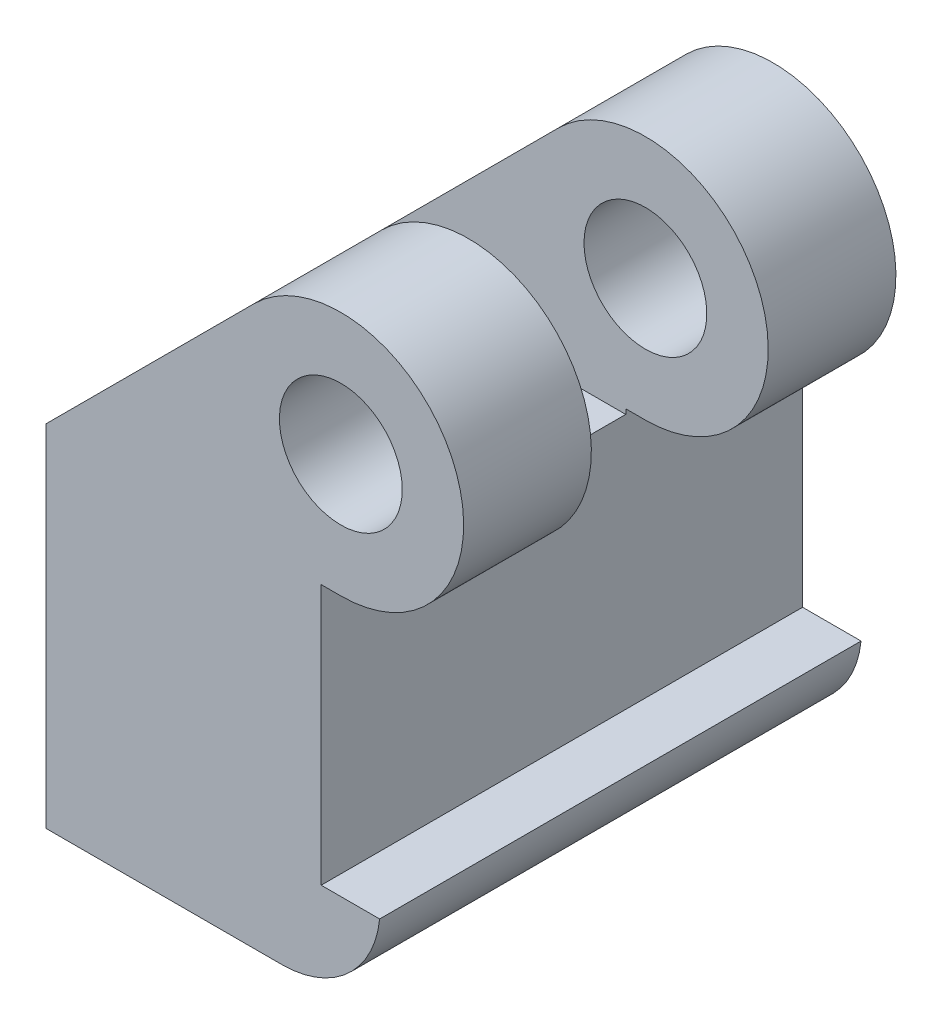
from build123d import *

# Parameters (mm, degrees)
OUTER_START                           = -1.143
OUTER_CLAMP_LATCH_FILLET1_DEPTH       = 6.223
OUTER_START_2                         = 3.556
OUTER_CLAMP_LATCH_FILLET1_2_OUTLINE_R = 0.79375
OUTER_CLAMP_LATCH_FILLET1_2_DEPTH     = 1.524
OUTER_START_3                         = -0.508
OUTER_CLAMP_LATCH_FILLET1_3_OUTLINE_R = 0.79375
OUTER_CLAMP_LATCH_FILLET1_3_DEPTH     = 1.651
OUTER_CLAMP_LATCH_FILLET1_4_DEPTH     = 1.524
OUTER_START_4                         = 3.429
OUTER_CLAMP_LATCH_FILLET1_5_OUTLINE_R = 0.79375
OUTER_CLAMP_LATCH_FILLET1_5_DEPTH     = 0.127
OUTER_START_5                         = -7.112
OUTER_CLAMP_LATCH_FILLET1_6_DEPTH     = 1.5875
OUTER_START_6                         = -5.207
OUTER_CLAMP_LATCH_FILLET1_7_OUTLINE_R = 0.508
OUTER_CLAMP_LATCH_FILLET1_7_DEPTH     = 2.54
SKETCH1_W                             = 0.762
SKETCH1_H                             = 1.651
CUT_EXTRUDE1_DEPTH                    = 13.139632435
EXTRUDE1_START                        = -2.8575
SKETCH2_R                             = 0.508
EXTRUDE1_DEPTH                        = 2.8575
SKETCH2_3_R                           = 0.508
CUT_EXTRUDE2_DEPTH                    = 1.905


with BuildPart() as part:
    # <Outer Clamp Latch>-<Fillet1>: read off the stored shape, not the designer's step
    # <Outer Clamp Latch>-<Fillet1> outline → <Outer Clamp Latch>-<Fillet1> (new body)
    with BuildSketch(Plane.XY.offset(OUTER_START)):
        with BuildLine():
            Line((-4.445, -5.5245), (-4.445, -7.105634045))
            ThreePointArc((-4.445, -7.105634045), (-3.630142792, -6.693941899), (-3.302, -5.842))
            Line((-3.302, -5.842), (-3.302, -4.318))
            Line((-3.302, -4.318), (-4.064, -4.318))
            Line((-4.064, -4.318), (-4.064, -2.667))
            Line((-4.064, -2.667), (-7.62, -2.667))
            Line((-7.62, -2.667), (-7.62, -5.5245))
            Line((-7.62, -5.5245), (-4.445, -5.5245))
        make_face()
    extrude(amount=OUTER_CLAMP_LATCH_FILLET1_DEPTH)

    # Outer Clamp Latch_-_Fillet1 2 outline → Outer Clamp Latch_-_Fillet1 2 (add)
    # profile 1 of 2: a face of its own
    with BuildSketch(Plane.XY.offset(OUTER_START_2)):
        with BuildLine():
            Line((-7.62, -7.112), (-4.572, -7.112))
            ThreePointArc((-4.572, -7.112), (-4.508420276, -7.110407513), (-4.445, -7.105634045))
            Line((-4.445, -7.105634045), (-4.445, -5.5245))
            Line((-4.445, -5.5245), (-7.62, -5.5245))
            Line((-7.62, -5.5245), (-7.62, -7.112))
        make_face()
    # profile 2 of 2: a face of its own
    with BuildSketch(Plane.XY.offset(OUTER_START_2)):
        with BuildLine():
            Line((-7.62, -2.58093597), (-7.62, -2.667))
            Line((-7.62, -2.667), (-4.064, -2.667))
            Line((-4.064, -2.667), (-4.064, -2.6035))
            Line((-4.064, -2.6035), (-3.81, -2.6035))
            ThreePointArc((-3.81, -2.6035), (-2.343341242, -0.408490051), (-4.932532015, 0.106532015))
            Line((-4.932532015, 0.106532015), (-7.62, -2.58093597))
        make_face()
        with Locations((-3.81, -1.016)):
            Circle(OUTER_CLAMP_LATCH_FILLET1_2_OUTLINE_R, mode=Mode.SUBTRACT)
    extrude(amount=OUTER_CLAMP_LATCH_FILLET1_2_DEPTH)

    # Outer Clamp Latch_-_Fillet1 3 outline → Outer Clamp Latch_-_Fillet1 3 (add)
    with BuildSketch(Plane.XY.offset(OUTER_START_3)):
        with BuildLine():
            Line((-7.62, -2.58093597), (-7.62, -2.667))
            Line((-7.62, -2.667), (-4.064, -2.667))
            Line((-4.064, -2.667), (-4.064, -2.6035))
            Line((-4.064, -2.6035), (-3.81, -2.6035))
            ThreePointArc((-3.81, -2.6035), (-2.343341242, -0.408490051), (-4.932532015, 0.106532015))
            Line((-4.932532015, 0.106532015), (-7.62, -2.58093597))
        make_face()
        with Locations((-3.81, -1.016)):
            Circle(OUTER_CLAMP_LATCH_FILLET1_3_OUTLINE_R, mode=Mode.SUBTRACT)
    extrude(amount=OUTER_CLAMP_LATCH_FILLET1_3_DEPTH)

    # Outer Clamp Latch_-_Fillet1 4 outline → Outer Clamp Latch_-_Fillet1 4 (add)
    with BuildSketch(Plane.XY.offset(OUTER_START)):
        with BuildLine():
            Line((-7.62, -7.112), (-4.572, -7.112))
            ThreePointArc((-4.572, -7.112), (-4.508420276, -7.110407513), (-4.445, -7.105634045))
            Line((-4.445, -7.105634045), (-4.445, -5.5245))
            Line((-4.445, -5.5245), (-7.62, -5.5245))
            Line((-7.62, -5.5245), (-7.62, -7.112))
        make_face()
    extrude(amount=OUTER_CLAMP_LATCH_FILLET1_4_DEPTH)

    # Outer Clamp Latch_-_Fillet1 5 outline → Outer Clamp Latch_-_Fillet1 5 (add)
    with BuildSketch(Plane.XY.offset(OUTER_START_4)):
        with BuildLine():
            Line((-7.62, -2.58093597), (-7.62, -2.667))
            Line((-7.62, -2.667), (-4.064, -2.667))
            Line((-4.064, -2.667), (-4.064, -2.6035))
            Line((-4.064, -2.6035), (-3.81, -2.6035))
            ThreePointArc((-3.81, -2.6035), (-2.343341242, -0.408490051), (-4.932532015, 0.106532015))
            Line((-4.932532015, 0.106532015), (-7.62, -2.58093597))
        make_face()
        with Locations((-3.81, -1.016)):
            Circle(OUTER_CLAMP_LATCH_FILLET1_5_OUTLINE_R, mode=Mode.SUBTRACT)
    extrude(amount=OUTER_CLAMP_LATCH_FILLET1_5_DEPTH)

    # Outer Clamp Latch_-_Fillet1 6 outline → Outer Clamp Latch_-_Fillet1 6 (cut)
    with BuildSketch(Plane(origin=(0, 0, 0), x_dir=(1, 0, 0), z_dir=(0, 1, 0)).offset(OUTER_START_5)):
        with BuildLine():
            ThreePointArc((-4.445, -0.381), (-5.23875, 0.41275), (-6.0325, -0.381))
            Line((-6.0325, -0.381), (-4.445, -0.381))
        make_face()
        with BuildLine():
            ThreePointArc((-6.0325, -3.556), (-5.23875, -4.34975), (-4.445, -3.556))
            Line((-4.445, -3.556), (-6.0325, -3.556))
        make_face()
    extrude(amount=OUTER_CLAMP_LATCH_FILLET1_6_DEPTH, mode=Mode.SUBTRACT)

    # Outer Clamp Latch_-_Fillet1 7 outline → Outer Clamp Latch_-_Fillet1 7 (cut)
    with BuildSketch(Plane(origin=(0, 0, 0), x_dir=(1, 0, 0), z_dir=(0, 1, 0)).offset(OUTER_START_6)):
        with Locations((-5.715, -1.778)):
            Circle(OUTER_CLAMP_LATCH_FILLET1_7_OUTLINE_R)
    extrude(amount=OUTER_CLAMP_LATCH_FILLET1_7_DEPTH, mode=Mode.SUBTRACT)

    # Sketch1 → Cut-Extrude1 (cut, through all)
    with BuildSketch(Plane.XY.offset(5.08)):
        with Locations((-3.683, -5.1435)):
            Rectangle(SKETCH1_W, SKETCH1_H)
    extrude(amount=-CUT_EXTRUDE1_DEPTH, mode=Mode.SUBTRACT)

    # Sketch2 → Extrude1 (add)
    with BuildSketch(Plane(origin=(0, -2.667, 0), x_dir=(-1, 0, 0), z_dir=(0, 1, 0)).offset(EXTRUDE1_START)):
        with Locations((5.715, 2.794)):
            Circle(SKETCH2_R)
        with Locations((5.715, 1.778)):
            Circle(SKETCH2_R)
    extrude(amount=EXTRUDE1_DEPTH)

    # Sketch2<3> → Cut-Extrude2 (cut)
    with BuildSketch(Plane(origin=(0, -2.667, 0), x_dir=(-1, 0, 0), z_dir=(0, 1, 0))):
        with Locations(Location((5.715, 2.794, 0), (0, 0, 180))):
            Circle(SKETCH2_3_R)
    extrude(amount=-CUT_EXTRUDE2_DEPTH, mode=Mode.SUBTRACT)


solid = part.part
